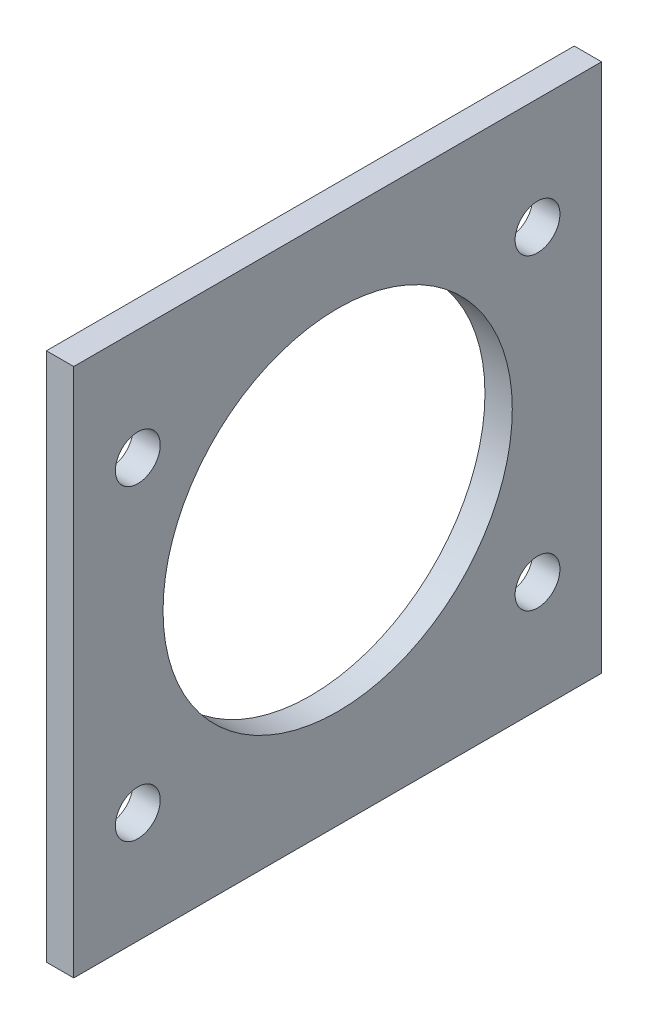
from build123d import *

# Parameters (mm, degrees)
SKETCH1_W           = 61.8
SKETCH1_H           = 62
BOSS_EXTRUDE1_DEPTH = 3.2
CUT_EXTRUDE1_REACH  = 89.598
SKETCH2_R           = 20.445
CUT_EXTRUDE2_REACH  = 89.598
SKETCH3_R           = 2.625


with BuildPart() as part:
    # Sketch1 → Boss-Extrude1 (new body)
    with BuildSketch(Plane(origin=(0, 0, 0), x_dir=(0, 0, -1), z_dir=(1, 0, 0))):
        with Locations((30.9, 31)):
            Rectangle(SKETCH1_W, SKETCH1_H)
    extrude(amount=BOSS_EXTRUDE1_DEPTH)

    # Sketch2 → Cut-Extrude1 (cut, up to next)
    with BuildSketch(Plane(origin=(3.2, 0, 0), x_dir=(0, 0, -1), z_dir=(1, 0, 0)), mode=Mode.PRIVATE) as cut_extrude1_sk1:
        with Locations((30.9, 32)):
            Circle(SKETCH2_R)
    cut_extrude1_tool1 = extrude(cut_extrude1_sk1.sketch, amount=-CUT_EXTRUDE1_REACH, mode=Mode.PRIVATE) & part.part
    add(cut_extrude1_tool1.solids().sort_by_distance((3.2, 32, -30.9))[0], mode=Mode.SUBTRACT)

    # Sketch3 → Cut-Extrude2 (cut, up to next)
    with BuildSketch(Plane.ZY, mode=Mode.PRIVATE) as cut_extrude2_sk1:
        with Locations((-54.3, 49)):
            Circle(SKETCH3_R)
    cut_extrude2_tool1 = extrude(cut_extrude2_sk1.sketch, amount=-CUT_EXTRUDE2_REACH, mode=Mode.PRIVATE) & part.part
    # Sketch3 → Cut-Extrude2 (cut, up to next)
    with BuildSketch(Plane.ZY, mode=Mode.PRIVATE) as cut_extrude2_sk2:
        with Locations((-54.3, 13)):
            Circle(SKETCH3_R)
    cut_extrude2_tool2 = extrude(cut_extrude2_sk2.sketch, amount=-CUT_EXTRUDE2_REACH, mode=Mode.PRIVATE) & part.part
    # Sketch3 → Cut-Extrude2 (cut, up to next)
    with BuildSketch(Plane.ZY, mode=Mode.PRIVATE) as cut_extrude2_sk3:
        with Locations((-7.5, 49)):
            Circle(SKETCH3_R)
    cut_extrude2_tool3 = extrude(cut_extrude2_sk3.sketch, amount=-CUT_EXTRUDE2_REACH, mode=Mode.PRIVATE) & part.part
    # Sketch3 → Cut-Extrude2 (cut, up to next)
    with BuildSketch(Plane.ZY, mode=Mode.PRIVATE) as cut_extrude2_sk4:
        with Locations((-7.5, 13)):
            Circle(SKETCH3_R)
    cut_extrude2_tool4 = extrude(cut_extrude2_sk4.sketch, amount=-CUT_EXTRUDE2_REACH, mode=Mode.PRIVATE) & part.part
    add(cut_extrude2_tool1.solids().sort_by_distance((0, 49, -54.3))[0], mode=Mode.SUBTRACT)
    add(cut_extrude2_tool2.solids().sort_by_distance((0, 13, -54.3))[0], mode=Mode.SUBTRACT)
    add(cut_extrude2_tool3.solids().sort_by_distance((0, 49, -7.5))[0], mode=Mode.SUBTRACT)
    add(cut_extrude2_tool4.solids().sort_by_distance((0, 13, -7.5))[0], mode=Mode.SUBTRACT)


solid = part.part
